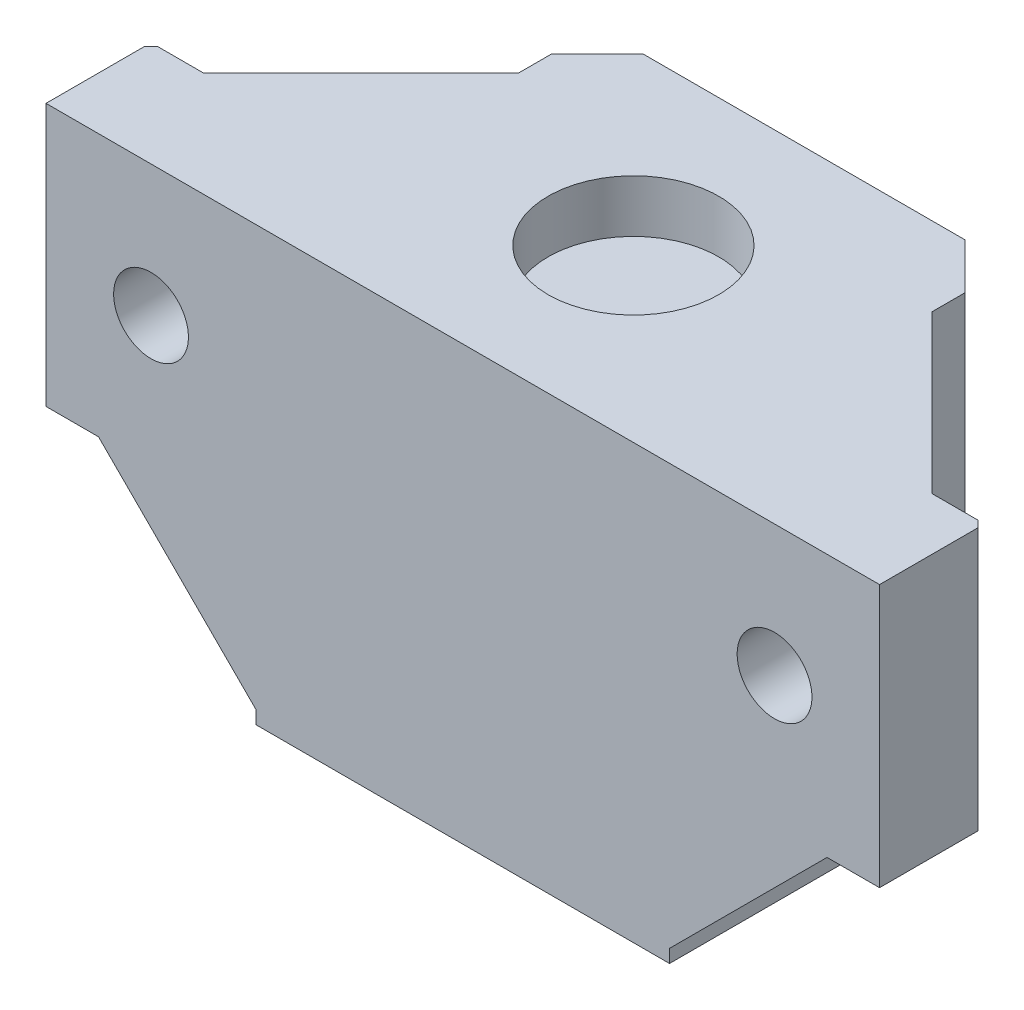
from build123d import *

# Parameters (mm, degrees)
SKETCH1_W           = 31.5
SKETCH1_H           = 26
BOSS_EXTRUDE1_DEPTH = 33
SKETCH8_W           = 16
SKETCH8_H           = 20
BOSS_EXTRUDE2_DEPTH = 8
CUT_EXTRUDE1_START  = 10
CUT_EXTRUDE1_DEPTH  = 40.164116391
SKETCH3_R           = 2.85
CUT_EXTRUDE2_DEPTH  = 50.204293512
SKETCH6_R           = 6.25
CUT_EXTRUDE5_DEPTH  = 2
SKETCH4_R           = 2.35
CUT_EXTRUDE3_DEPTH  = 50.164116391
SKETCH5_R           = 6.5
CUT_EXTRUDE4_DEPTH  = 4
CHAMFER1_SIZE       = 3.5
CHAMFER3_SIZE       = 0.5
CHAMFER4_SIZE       = 12
CHAMFER5_SIZE       = 12
SKETCH10_R          = 4.428091906
BOSS_EXTRUDE4_DEPTH = 0.65
SKETCH11_R          = 4.527005536
SKETCH11_R_2        = 4.450513295
BOSS_EXTRUDE5_DEPTH = 0.65


with BuildPart() as part:
    # Sketch1 → Boss-Extrude1 (new body)
    with BuildSketch(Plane(origin=(0, 0, 0), x_dir=(1, 0, 0), z_dir=(0, 1, 0))):
        with Locations((0, -4.889880952)):
            Rectangle(SKETCH1_W, SKETCH1_H)
    extrude(amount=BOSS_EXTRUDE1_DEPTH)

    # Sketch8 → Boss-Extrude2 (add)
    with BuildSketch(Plane.XY.offset(17.889880952)):
        with Locations((23.75, 23)):
            Rectangle(SKETCH8_W, SKETCH8_H)
        with Locations((-23.75, 23)):
            Rectangle(SKETCH8_W, SKETCH8_H)
    extrude(amount=-BOSS_EXTRUDE2_DEPTH)

    # Sketch2 → Cut-Extrude1 (cut, through all)
    with BuildSketch(Plane.XZ.offset(-33).offset(CUT_EXTRUDE1_START)):
        Polygon((-11.25, 14.389880952), (-5.5, 14.389880952), (-5.5, 11.389880952), (5.5, 11.389880952), (5.5, 14.389880952), (11.25, 14.389880952), (11.25, -4.610119048), (5.5, -4.610119048), (5.5, -1.610119048), (-5.5, -1.610119048), (-5.5, -4.610119048), (-11.25, -4.610119048), align=None)
    extrude(amount=CUT_EXTRUDE1_DEPTH, mode=Mode.SUBTRACT)

    # Sketch3 → Cut-Extrude2 (cut, through all)
    with BuildSketch(Plane(origin=(0, 0, 9.889880952), x_dir=(-1, 0, 0), z_dir=(0, 0, -1))):
        with Locations((-23.75, 23)):
            Circle(SKETCH3_R)
        with Locations((23.75, 23)):
            Circle(SKETCH3_R)
    extrude(amount=-CUT_EXTRUDE2_DEPTH, mode=Mode.SUBTRACT)

    # Sketch6 → Cut-Extrude5 (cut)
    with BuildSketch(Plane(origin=(0, 0, 9.889880952), x_dir=(-1, 0, 0), z_dir=(0, 0, -1))):
        with Locations((-23.75, 23)):
            Circle(SKETCH6_R)
        with Locations((23.75, 23)):
            Circle(SKETCH6_R)
    extrude(amount=-CUT_EXTRUDE5_DEPTH, mode=Mode.SUBTRACT)

    # Sketch4 → Cut-Extrude3 (cut, through all)
    with BuildSketch(Plane(origin=(0, 33, 0), x_dir=(1, 0, 0), z_dir=(0, 1, 0))):
        with Locations(Location((0, -4.889880952, 0), (0, 0, 270))):
            Circle(SKETCH4_R)
    extrude(amount=-CUT_EXTRUDE3_DEPTH, mode=Mode.SUBTRACT)

    # Sketch5 → Cut-Extrude4 (cut)
    with BuildSketch(Plane(origin=(0, 33, 0), x_dir=(1, 0, 0), z_dir=(0, 1, 0))):
        with Locations(Location((0, -4.889880952, 0), (0, 0, 270))):
            Circle(SKETCH5_R)
    extrude(amount=-CUT_EXTRUDE4_DEPTH, mode=Mode.SUBTRACT)

    # Chamfer1
    chamfer1_edges = [part.edges().sort_by_distance(p)[0] for p in [
        (-15.75, 16.5, -8.110119048),
        (15.75, 16.5, -8.110119048),
    ]]
    chamfer(chamfer1_edges, length=CHAMFER1_SIZE)

    # Chamfer3
    chamfer3_edges = [part.edges().sort_by_distance(p)[0] for p in [
        (31.75, 23, 9.889880952),
        (-31.75, 23, 9.889880952),
    ]]
    chamfer(chamfer3_edges, length=CHAMFER3_SIZE)

    # Chamfer4
    # the kernel refuses this chamfer: 12 mm, written as the material it adds along each edge
    with BuildSketch(Plane(origin=(15.75, 13, 9.889880952), x_dir=(-0.027495876610586348, 0, -0.9996219169112968), z_dir=(0, 1, 0))) as chamfer4_piece_1_section:
        Polygon((CHAMFER4_SIZE * 0.999621916911, -CHAMFER4_SIZE * 0.0274958766106), (-CHAMFER4_SIZE * 0.0274958766106, -CHAMFER4_SIZE * 0.999621916911), (0, 0), align=None)
    chamfer4_piece_1 = extrude(amount=20, mode=Mode.PRIVATE)
    chamfer4_piece_1 = chamfer4_piece_1 - Plane(origin=(23.75, 23, -0.26462775), x_dir=(-1, 0, 0), z_dir=(0, 0, -1)) * Cylinder(6.25, 88, mode=Mode.PRIVATE)
    add(chamfer4_piece_1)
    with BuildSketch(Plane(origin=(-15.75, 13, 9.889880952), x_dir=(-0.9996219169112969, 0, 0.027495876610586348), z_dir=(0, 1, 0))) as chamfer4_piece_2_section:
        Polygon((CHAMFER4_SIZE * 0.999621916911, -CHAMFER4_SIZE * 0.0274958766106), (-CHAMFER4_SIZE * 0.0274958766106, -CHAMFER4_SIZE * 0.999621916911), (0, 0), align=None)
    chamfer4_piece_2 = extrude(amount=20, mode=Mode.PRIVATE)
    chamfer4_piece_2 = chamfer4_piece_2 - Plane(origin=(-23.75, 23, 8.187920604), x_dir=(-1, 0, 0), z_dir=(0, 0, -1)) * Cylinder(6.25, 88, mode=Mode.PRIVATE)
    add(chamfer4_piece_2)

    # Chamfer5
    chamfer5_edges = [part.edges().sort_by_distance(p)[0] for p in [
        (-15.75, 13, 7.889880952),
        (15.75, 13, 7.889880952),
    ]]
    chamfer(chamfer5_edges, length=CHAMFER5_SIZE)

    # Sketch10 → Boss-Extrude4 (add)
    with BuildSketch(Plane(origin=(0, 29, 0), x_dir=(1, 0, 0), z_dir=(0, 1, 0))):
        with Locations((0, -4.889880952)):
            Circle(SKETCH10_R)
    extrude(amount=-BOSS_EXTRUDE4_DEPTH)

    # Sketch11 → Boss-Extrude5 (add)
    with BuildSketch(Plane(origin=(0, 0, 11.889880952), x_dir=(-1, 0, 0), z_dir=(0, 0, -1))):
        with Locations((-23.75, 23)):
            Circle(SKETCH11_R)
        with Locations((23.75, 23)):
            Circle(SKETCH11_R_2)
    extrude(amount=-BOSS_EXTRUDE5_DEPTH)


solid = part.part
